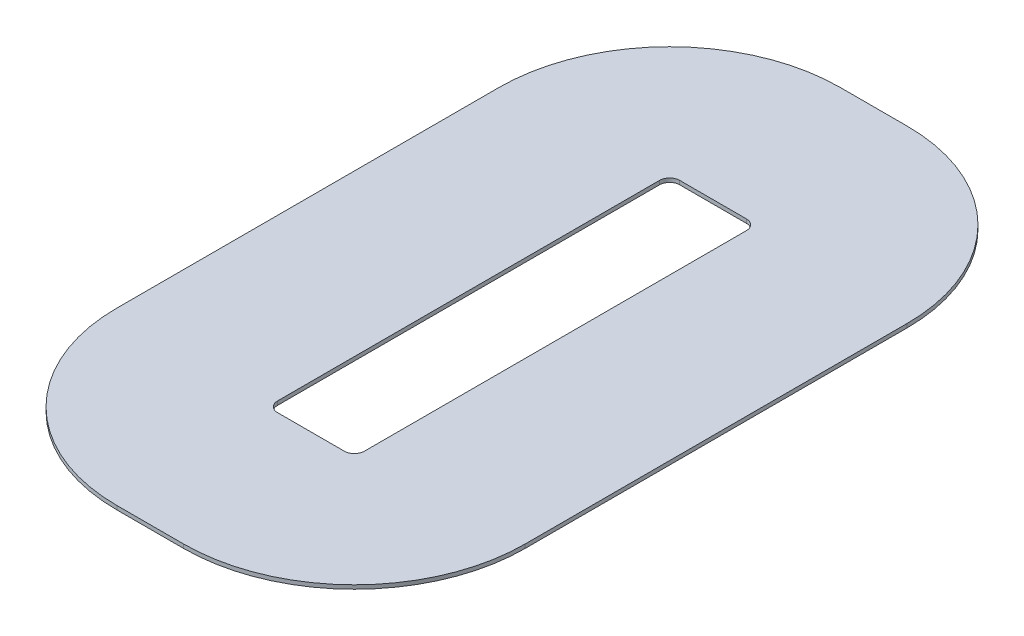
from build123d import *

# Parameters (mm, degrees)
SM_BASE_FLANGE_1_DEPTH = 0.5


# Sheet-metal steps are written as plain solids
with BuildPart() as part:
    # Sketch 1 → Базовая кромка1 (new body)
    with BuildSketch(Plane(origin=(0, 0, 0), x_dir=(1, 0, 0), z_dir=(0, 1, 0))):
        with BuildLine():
            Line((-4.3, 46.6), (4.3, 46.6))
            ThreePointArc((4.3, 46.6), (19.856349186, 40.156349186), (26.3, 24.6))
            Line((26.3, 24.6), (26.3, -24.6))
            ThreePointArc((26.3, -24.6), (19.856349186, -40.156349186), (4.3, -46.6))
            Line((4.3, -46.6), (-4.3, -46.6))
            ThreePointArc((-4.3, -46.6), (-19.856349186, -40.156349186), (-26.3, -24.6))
            Line((-26.3, -24.6), (-26.3, 24.6))
            ThreePointArc((-26.3, 24.6), (-19.856349186, 40.156349186), (-4.3, 46.6))
        make_face()
        with BuildLine():
            Line((-4.3, 25.9), (4.3, 25.9))
            ThreePointArc((4.3, 25.9), (5.219238816, 25.519238816), (5.6, 24.6))
            Line((5.6, 24.6), (5.6, -24.6))
            ThreePointArc((5.6, -24.6), (5.219238816, -25.519238816), (4.3, -25.9))
            Line((4.3, -25.9), (-4.3, -25.9))
            ThreePointArc((-4.3, -25.9), (-5.219238816, -25.519238816), (-5.6, -24.6))
            Line((-5.6, -24.6), (-5.6, 24.6))
            ThreePointArc((-5.6, 24.6), (-5.219238816, 25.519238816), (-4.3, 25.9))
        make_face(mode=Mode.SUBTRACT)
    extrude(amount=-SM_BASE_FLANGE_1_DEPTH)


solid = part.part
